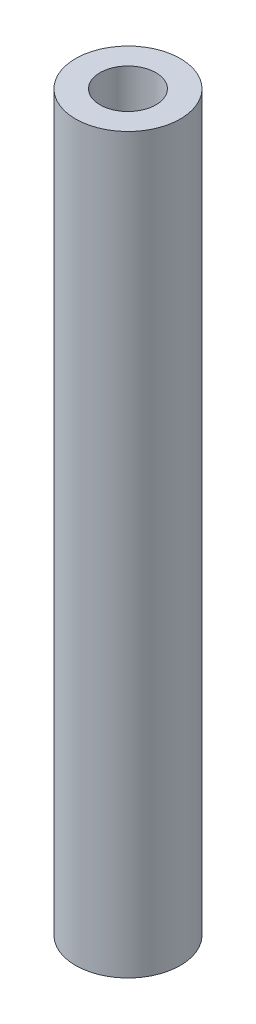
from build123d import *

# Parameters (mm, degrees)
SKETCH1_R           = 4.7625
SKETCH1_R_2         = 2.54
BOSS_EXTRUDE1_DEPTH = 66.675


with BuildPart() as part:
    # Sketch1 → Boss-Extrude1 (new body)
    with BuildSketch(Plane(origin=(0, 0, 0), x_dir=(1, 0, 0), z_dir=(0, 1, 0))):
        Circle(SKETCH1_R)
        Circle(SKETCH1_R_2, mode=Mode.SUBTRACT)
    extrude(amount=BOSS_EXTRUDE1_DEPTH)


solid = part.part
